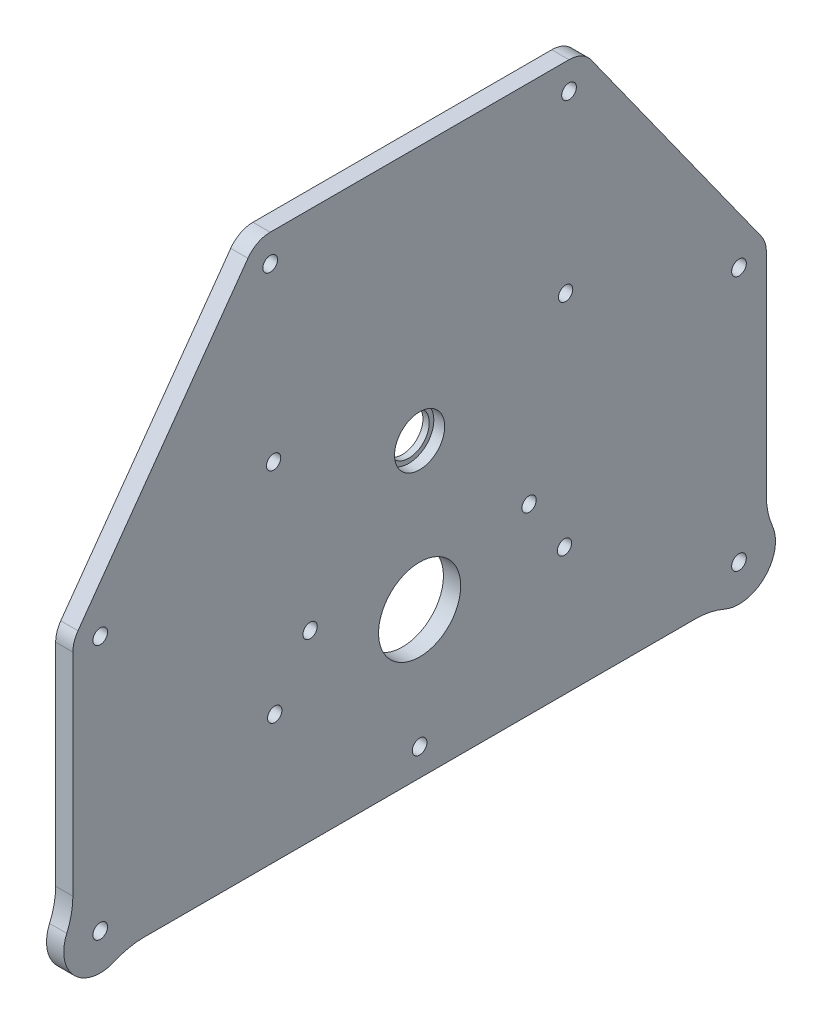
from build123d import *
from build123d.topology import SkipClean

# Parameters (mm, degrees)
ANGLEDBALLAST_DECKFRONT_OUTLINE_R = 2.5527
ANGLEDBALLAST_DECKFRONT_DEPTH     = 6.35
SKETCH1_R                         = 2.5527
BOSS_EXTRUDE1_DEPTH               = 5.9944
SKETCH2_R                         = 7.14375
SKETCH2_R_2                       = 14.2875
CUT_EXTRUDE1_DEPTH                = 344.885135927
F_10_CLEARANCE_HOLE1_AT_2_COUNT   = 2
F_10_CLEARANCE_HOLE1_AT_2_PITCH   = 58.544107304
F_10_CLEARANCE_HOLE1_AT_3_COUNT   = 2
F_10_CLEARANCE_HOLE1_AT_3_PITCH   = 105.685062805
F_10_CLEARANCE_HOLE1_AT_4_COUNT   = 2
F_10_CLEARANCE_HOLE1_AT_4_PITCH   = 76.2
F_10_CLEARANCE_HOLE1_AT_5_COUNT   = 2
F_10_CLEARANCE_HOLE1_AT_5_PITCH   = 90.539312574
F_10_CLEARANCE_HOLE1_AT_6_COUNT   = 2
F_10_CLEARANCE_HOLE1_AT_6_PITCH   = 22.719352983
SKETCH6_R                         = 12.7
SKETCH6_R_2                       = 2.5527
BOSS_EXTRUDE2_DEPTH               = 5.9944
FILLET1_R                         = 25.4
CUT_EXTRUDE2_DEPTH                = 233.633802265
FILLET2_R                         = 9.525
SKETCH8_R                         = 8.73125
CUT_EXTRUDE3_DEPTH                = 3.7846


# Read off the part's stored shape, not the designer's step: Surface Bodies1
with BuildPart() as part:
    # AngledBallast_DeckFront outline → AngledBallast_DeckFront (new body)
    with BuildSketch(Plane.YZ):
        Polygon((227.241295543, 95.25), (0, 257.81), (0, -257.81), (227.241295543, -95.25), align=None)
        with Locations((15.875, -111.125)):
            Circle(ANGLEDBALLAST_DECKFRONT_OUTLINE_R, mode=Mode.SUBTRACT)
        with Locations((104.656174089, -111.125)):
            Circle(ANGLEDBALLAST_DECKFRONT_OUTLINE_R, mode=Mode.SUBTRACT)
        with Locations((187.325, -51.986786112)):
            Circle(ANGLEDBALLAST_DECKFRONT_OUTLINE_R, mode=Mode.SUBTRACT)
        with Locations((15.875, 0)):
            Circle(ANGLEDBALLAST_DECKFRONT_OUTLINE_R, mode=Mode.SUBTRACT)
        with Locations((15.875, 111.125)):
            Circle(ANGLEDBALLAST_DECKFRONT_OUTLINE_R, mode=Mode.SUBTRACT)
        Polygon((101.6, -101.6), (25.4, -101.6), (25.4, 101.6), (101.6, 101.6), (177.8, 47.089344398), (177.8, -47.089344398), align=None, mode=Mode.SUBTRACT)
        with Locations((104.656174089, 111.125)):
            Circle(ANGLEDBALLAST_DECKFRONT_OUTLINE_R, mode=Mode.SUBTRACT)
        with Locations((187.325, 51.986786112)):
            Circle(ANGLEDBALLAST_DECKFRONT_OUTLINE_R, mode=Mode.SUBTRACT)
    extrude(amount=ANGLEDBALLAST_DECKFRONT_DEPTH)


with BuildPart() as body_2:
    # Sketch1 → Boss-Extrude1 (new body)
    with BuildSketch(Plane(origin=(6.35, 0, 0), x_dir=(0, 0, -1), z_dir=(1, 0, 0))):
        Polygon((120.65, 107.712348179), (56.884227826, 196.85), (-56.884227826, 196.85), (-120.65, 107.712348179), (-120.65, 6.35), (120.65, 6.35), align=None)
        with Locations(Location((51.986786112, 187.325, 0), (0, 0, 180))):
            Circle(SKETCH1_R, mode=Mode.SUBTRACT)
        with Locations(Location((111.125, 104.656174089, 0), (0, 0, 180))):
            Circle(SKETCH1_R, mode=Mode.SUBTRACT)
        with Locations(Location((0, 15.875, 0), (0, 0, 180))):
            Circle(SKETCH1_R, mode=Mode.SUBTRACT)
        with Locations(Location((111.125, 15.875, 0), (0, 0, 180))):
            Circle(SKETCH1_R, mode=Mode.SUBTRACT)
        with Locations(Location((-111.125, 15.875, 0), (0, 0, 180))):
            Circle(SKETCH1_R, mode=Mode.SUBTRACT)
        with Locations(Location((-111.125, 104.656174089, 0), (0, 0, 180))):
            Circle(SKETCH1_R, mode=Mode.SUBTRACT)
        with Locations(Location((-51.986786112, 187.325, 0), (0, 0, 180))):
            Circle(SKETCH1_R, mode=Mode.SUBTRACT)
    extrude(amount=BOSS_EXTRUDE1_DEPTH)

    # Sketch2 → Cut-Extrude1 (cut, through all)
    with BuildSketch(Plane(origin=(12.3444, 0, 0), x_dir=(0, 0, -1), z_dir=(1, 0, 0))):
        with Locations((0, 108.0008)):
            Circle(SKETCH2_R)
        with Locations((0, 57.15)):
            Circle(SKETCH2_R_2)
    extrude(amount=-CUT_EXTRUDE1_DEPTH, mode=Mode.SUBTRACT)

    # Sketch5 → #10 Clearance Hole1 (revolve, cut)
    with BuildSketch(Plane(origin=(12.3444, 69.9008, -38.1), x_dir=(0, 0, -1), z_dir=(0, 1, 0))):
        Polygon((0, 0), (0, 13.433662253), (2.4892, 11.938), (2.4892, 0), align=None)
    f_10_clearance_hole1 = revolve(axis=Axis((18.6944, 69.9008, -38.1), (-1, 0, 0)), mode=Mode.SUBTRACT)

    # #10 Clearance Hole1 at 2: #10 Clearance Hole1 ×2
    with Locations(*[Vector(0, 0.9761870601839528, -0.2169304578186562) * (i * F_10_CLEARANCE_HOLE1_AT_2_PITCH) for i in range(1, F_10_CLEARANCE_HOLE1_AT_2_COUNT)]):
        add(f_10_clearance_hole1, mode=Mode.SUBTRACT)

    # #10 Clearance Hole1 at 3: #10 Clearance Hole1 ×2
    with Locations(*[Vector(0, 0.5407575913134985, 0.8411784753765537) * (i * F_10_CLEARANCE_HOLE1_AT_3_PITCH) for i in range(1, F_10_CLEARANCE_HOLE1_AT_3_COUNT)]):
        add(f_10_clearance_hole1, mode=Mode.SUBTRACT)

    # #10 Clearance Hole1 at 4: #10 Clearance Hole1 ×2
    with Locations(*[(0, 0, i * F_10_CLEARANCE_HOLE1_AT_4_PITCH) for i in range(1, F_10_CLEARANCE_HOLE1_AT_4_COUNT)]):
        add(f_10_clearance_hole1, mode=Mode.SUBTRACT)

    # #10 Clearance Hole1 at 5: #10 Clearance Hole1 ×2
    with Locations(*[Vector(0, -0.2109669209657333, 0.9774932011314648) * (i * F_10_CLEARANCE_HOLE1_AT_5_PITCH) for i in range(1, F_10_CLEARANCE_HOLE1_AT_5_COUNT)]):
        add(f_10_clearance_hole1, mode=Mode.SUBTRACT)

    # #10 Clearance Hole1 at 6: #10 Clearance Hole1 ×2
    with Locations(*[Vector(0, -0.8407281674761526, -0.5414574299168776) * (i * F_10_CLEARANCE_HOLE1_AT_6_PITCH) for i in range(1, F_10_CLEARANCE_HOLE1_AT_6_COUNT)]):
        add(f_10_clearance_hole1, mode=Mode.SUBTRACT)

    # Sketch6 → Boss-Extrude2 (add)
    # profile 1 of 2: a face of its own
    with BuildSketch(Plane(origin=(12.3444, 0, 0), x_dir=(0, 0, -1), z_dir=(1, 0, 0))):
        with Locations((-111.125, 15.875)):
            Circle(SKETCH6_R)
        with Locations(Location((-111.125, 15.875, 0), (0, 0, 180))):
            Circle(SKETCH6_R_2, mode=Mode.SUBTRACT)
    # profile 2 of 2: a face of its own
    with BuildSketch(Plane(origin=(12.3444, 0, 0), x_dir=(0, 0, -1), z_dir=(1, 0, 0))):
        with Locations((111.125, 15.875)):
            Circle(SKETCH6_R)
        with Locations(Location((111.125, 15.875, 0), (0, 0, 180))):
            Circle(SKETCH6_R_2, mode=Mode.SUBTRACT)
    extrude(amount=-BOSS_EXTRUDE2_DEPTH)

    # Fillet1
    fillet1_edges = [body_2.edges().sort_by_distance(p)[0] for p in [
        (9.3472, 6.35, 102.724739587),
        (9.3472, 24.275260413, 120.65),
        (9.3472, 6.35, -102.724739587),
        (9.3472, 24.275260413, -120.65),
    ]]
    fillet(fillet1_edges, radius=FILLET1_R)

    # Sketch7 → Cut-Extrude2 (cut, through all)
    with BuildSketch(Plane(origin=(12.3444, 0, 0), x_dir=(0, 0, -1), z_dir=(1, 0, 0))):
        with BuildLine():
            Line((119.525260413, 6.35), (120.65, 6.35))
            Line((120.65, 6.35), (120.65, 7.474739587))
            ThreePointArc((120.65, 7.474739587), (120.105256121, 6.894743879), (119.525260413, 6.35))
        make_face()
        with BuildLine():
            Line((-120.65, 6.35), (-119.525260413, 6.35))
            ThreePointArc((-119.525260413, 6.35), (-120.105256121, 6.894743879), (-120.65, 7.474739587))
            Line((-120.65, 7.474739587), (-120.65, 6.35))
        make_face()
    extrude(amount=-CUT_EXTRUDE2_DEPTH, mode=Mode.SUBTRACT)

    # Fillet2
    fillet2_edges = [body_2.edges().sort_by_distance(p)[0] for p in [
        (9.3472, 107.712348179, 120.65),
        (9.3472, 196.85, 56.884227826),
        (9.3472, 196.85, -56.884227826),
        (9.3472, 107.712348179, -120.65),
    ]]
    fillet(fillet2_edges, radius=FILLET2_R)

    # Sketch8 → Cut-Extrude3 (cut)
    with SkipClean():  # the faces are left unmerged after this step: merging them gives an invalid solid
        with BuildSketch(Plane(origin=(12.3444, 0, 0), x_dir=(0, 0, -1), z_dir=(1, 0, 0))):
            with Locations((0, 108.0008)):
                Circle(SKETCH8_R)
        extrude(amount=-CUT_EXTRUDE3_DEPTH, mode=Mode.SUBTRACT)


solid = body_2.part
